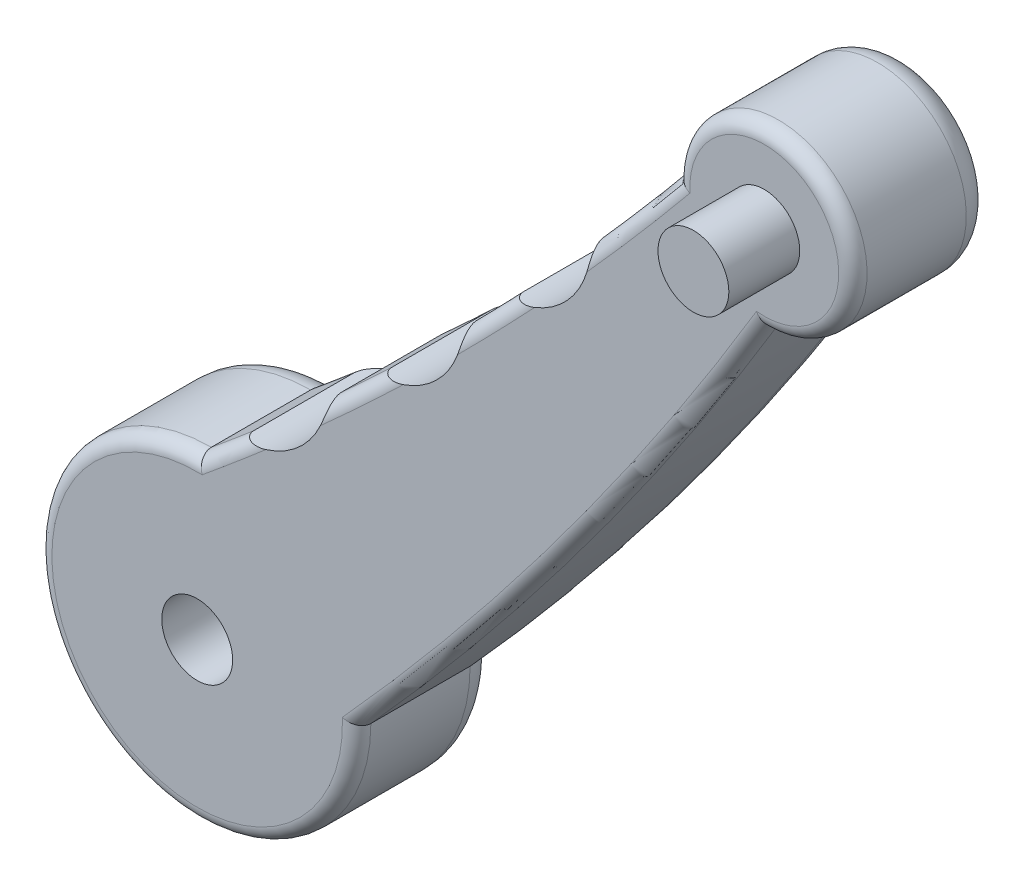
from build123d import *

# Parameters (mm, degrees)
BOSS_EXTRUDE1_DEPTH      = 10
FILLET1_R                = 2
SKETCH2_R                = 5
BOSS_EXTRUDE2_DEPTH      = 10
SKETCH2_3_R              = 5
CUT_EXTRUDE1_DEPTH       = 10
FILLET2_R                = 4
SKETCH3_R                = 12.5
BOSS_EXTRUDE3_DEPTH      = 5
FILLET3_R                = 5
SKETCH4_R                = 2.5
CUT_EXTRUDE2_DEPTH       = 5
CIRPATTERN1_COUNT        = 8
SKETCH5_R                = 1.75
BOSS_EXTRUDE5_DEPTH      = 2
FILLET5_R                = 1
CIRPATTERN5_COUNT        = 8
FILLET5_OF_CIRPATTERN5_R = 1
SKETCH6_R                = 5
CUT_EXTRUDE3_DEPTH       = 2
CUT_EXTRUDE4_DEPTH       = 141.312152161
CUT_EXTRUDE4_DEPTH_BACK  = 141.312152161
SKETCH7_R                = 12.5


with BuildPart() as part:
    # Sketch1 → Boss-Extrude1 (new, symmetric)
    with BuildSketch(Plane.XY):
        with BuildLine():
            ThreePointArc((0, 22.5), (-15.909902577, -15.909902577), (22.5, 0))
            ThreePointArc((22.5, 0), (53.124085909, 37.359549165), (80, 77.5))
            ThreePointArc((80, 77.5), (88.838834765, 98.838834765), (67.5, 90))
            ThreePointArc((67.5, 90), (35.364564233, 54.635435767), (0, 22.5))
        make_face()
    extrude(amount=BOSS_EXTRUDE1_DEPTH, both=True)

    # Fillet1
    fillet1_edges = [part.edges().sort_by_distance(p)[0] for p in [
        (-15.909902577, -15.909902577, 10),
        (35.364564233, 54.635435767, 10),
        (88.838834765, 98.838834765, 10),
        (53.124085909, 37.359549165, 10),
    ]]
    fillet(fillet1_edges, radius=FILLET1_R)

    # Sketch2 → Boss-Extrude2 (add)
    with BuildSketch(Plane.XY.offset(10)):
        with Locations((80, 90)):
            Circle(SKETCH2_R)
    extrude(amount=BOSS_EXTRUDE2_DEPTH)

    # Sketch2<3> → Cut-Extrude1 (cut)
    with BuildSketch(Plane.XY.offset(10)):
        Circle(SKETCH2_3_R)
    extrude(amount=-CUT_EXTRUDE1_DEPTH, mode=Mode.SUBTRACT)

    # Fillet2
    fillet2_edges = [part.edges().sort_by_distance(p)[0] for p in [
        (-15.909902577, -15.909902577, -10),
        (35.364564233, 54.635435767, -10),
        (88.838834765, 98.838834765, -10),
        (53.124085909, 37.359549165, -10),
    ]]
    fillet(fillet2_edges, radius=FILLET2_R)

    # Sketch3 → Boss-Extrude3 (add)
    with BuildSketch(Plane(origin=(0, 0, -10), x_dir=(-1, 0, 0), z_dir=(0, 0, -1))):
        with Locations(Location((0, 0, 0), (0, 0, 180))):
            Circle(SKETCH3_R)
    extrude(amount=BOSS_EXTRUDE3_DEPTH)

    # Fillet3
    fillet3_edges = [part.edges().sort_by_distance(p)[0] for p in [
        (-12.5, 0, -15),
    ]]
    fillet(fillet3_edges, radius=FILLET3_R - 0.0001)  # a hair under: the kernel refuses the full size

    # Sketch4 → Cut-Extrude2 (cut)
    with BuildSketch(Plane(origin=(0, 0, -15), x_dir=(-1, 0, 0), z_dir=(0, 0, -1))):
        with Locations((0, 12.5)):
            Circle(SKETCH4_R)
    cut_extrude2 = extrude(amount=-CUT_EXTRUDE2_DEPTH, mode=Mode.SUBTRACT)

    # CirPattern1: Cut-Extrude2 ×8 about axis
    cirpattern1_axis = Axis((0, 0, 0), (0, 0, 1))
    for i in range(1, CIRPATTERN1_COUNT):
        add(cut_extrude2.rotate(cirpattern1_axis, i * 360 / CIRPATTERN1_COUNT), mode=Mode.SUBTRACT)

    # Sketch5 → Boss-Extrude5 (add)
    with BuildSketch(Plane(origin=(0, 0, -10), x_dir=(-1, 0, 0), z_dir=(0, 0, -1))):
        with Locations(Location((8.838834765, 8.838834765, 0), (0, 0, 180))):
            Circle(SKETCH5_R)
    boss_extrude5 = extrude(amount=BOSS_EXTRUDE5_DEPTH)

    # Fillet5
    fillet5_edges = [part.edges().sort_by_distance(p)[0] for p in [
        (-10.588834765, 8.838834765, -12),
    ]]
    fillet(fillet5_edges, radius=FILLET5_R)

    # CirPattern5: Boss-Extrude5 ×8 about axis
    cirpattern5_axis = Axis((0, 0, 0), (0, 0, 1))
    for i in range(1, CIRPATTERN5_COUNT):
        add(boss_extrude5.rotate(cirpattern5_axis, i * 360 / CIRPATTERN5_COUNT))

    # Fillet5 of CirPattern5
    fillet5_of_cirpattern5_edges = [part.edges().sort_by_distance(p)[0] for p in [
        (-13.737436867, -1.237436867, -12),
        (-8.838834765, -10.588834765, -12),
        (1.237436867, -13.737436867, -12),
        (10.588834765, -8.838834765, -12),
        (13.737436867, 1.237436867, -12),
        (8.838834765, 10.588834765, -12),
        (-1.237436867, 13.737436867, -12),
    ]]
    fillet(fillet5_of_cirpattern5_edges, radius=FILLET5_OF_CIRPATTERN5_R)

    # Sketch6 → Cut-Extrude3 (cut)
    with BuildSketch(Plane(origin=(0, 0, -10), x_dir=(-1, 0, 0), z_dir=(0, 0, -1))):
        with Locations(Location((-80, 90, 0), (0, 0, 180))):
            Circle(SKETCH6_R)
        with BuildLine():
            ThreePointArc((-56.958187971, 67.140856658), (-36.336351376, 45.751385757), (-14.496987956, 25.606614342))
            ThreePointArc((-14.496987956, 25.606614342), (-14.109192474, 13.893448969), (-25.819398512, 14.362173788))
            ThreePointArc((-25.819398512, 14.362173788), (-44.890195068, 38.042008355), (-62.465028921, 62.852390486))
            ThreePointArc((-62.465028921, 62.852390486), (-61.698429105, 67.547909959), (-56.958187971, 67.140856658))
        make_face()
    extrude(amount=-CUT_EXTRUDE3_DEPTH, mode=Mode.SUBTRACT)

    # Sketch7 → Cut-Extrude4 (cut, two sides: drawn at the far end of the back side and taken through both)
    with BuildSketch(Plane.XY.offset(10).offset(-CUT_EXTRUDE4_DEPTH_BACK)):
        with Locations((6, 40)):
            Circle(SKETCH7_R)
        with Locations((25, 57.5)):
            Circle(SKETCH7_R)
        with Locations((43, 76)):
            Circle(SKETCH7_R)
    extrude(amount=CUT_EXTRUDE4_DEPTH + CUT_EXTRUDE4_DEPTH_BACK, mode=Mode.SUBTRACT)


solid = part.part
